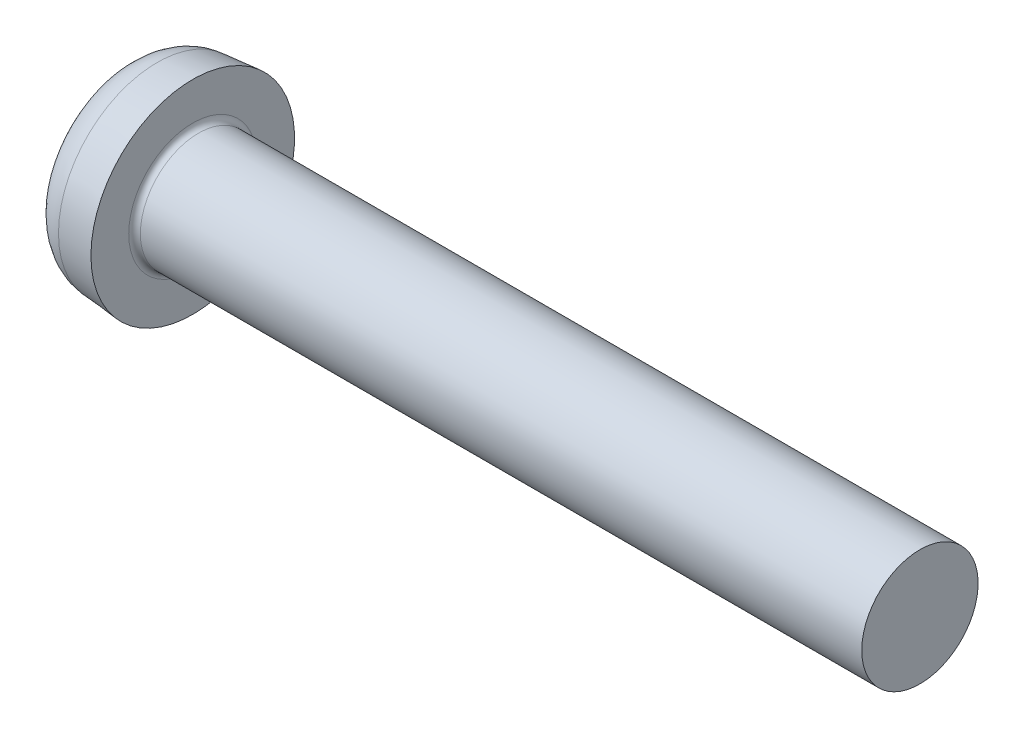
from build123d import *

# Parameters (mm, degrees)
FILLET1_R    = 0.4
RECPAT_COUNT = 2
RECPAT_ANGLE = 90


with BuildPart() as part:
    # BodySke → BaseBody (revolve)
    with BuildSketch(Plane.XY):
        with BuildLine():
            Line((5.4, 4), (5.4, 7))
            Line((5.4, 7), (2.956076559, 6.786184404))
            ThreePointArc((2.956076559, 6.786184404), (1.52557938, 6.199578276), (0.681056287, 4.904506975))
            ThreePointArc((0.681056287, 4.904506975), (0.171077054, 2.475784034), (0, 0))
            Line((0, 0), (55.4, 0))
            Line((55.4, 0), (55.4, 4))
            Line((55.4, 4), (5.4, 4))
        make_face()
    revolve(axis=Axis((0, 0, 0), (1, 0, 0)))

    # Fillet1
    fillet1_edges = [part.edges().sort_by_distance(p)[0] for p in [
        (5.4, -4, 0),
    ]]
    fillet(fillet1_edges, radius=FILLET1_R)

    # RecSkeTop → Recess section 0
    with BuildSketch(Plane(origin=(0, 0, 0), x_dir=(0, 0, -1), z_dir=(1, 0, 0))):
        with BuildLine():
            Line((-0.858, 3.9), (0.858, 3.9))
            Line((0.858, 3.9), (0.858, -3.9))
            Line((0.858, -3.9), (-0.858, -3.9))
            Line((-0.858, -3.9), (-0.858, 3.9))
        make_face()
    # RecSkeBot → Recess section 1
    with BuildSketch(Plane(origin=(4.36, 0, 0), x_dir=(0, 0, -1), z_dir=(1, 0, 0))):
        with BuildLine():
            Line((-0.858, 1.726184552), (0.858, 1.726184552))
            Line((0.858, 1.726184552), (0.858, -1.726184552))
            Line((0.858, -1.726184552), (-0.858, -1.726184552))
            Line((-0.858, -1.726184552), (-0.858, 1.726184552))
        make_face()
    recess = loft(mode=Mode.SUBTRACT)

    # RecPat: Recess ×2 about axis
    recpat_axis = Axis((0, 0, 0), (1, 0, 0))
    for i in range(1, RECPAT_COUNT):
        add(recess.rotate(recpat_axis, i * RECPAT_ANGLE / (RECPAT_COUNT - 1)), mode=Mode.SUBTRACT)

    # RecCorSke → RecessCore (revolve, cut)
    with BuildSketch(Plane.XY):
        Polygon((0, 0), (0, 1.8876), (4.36, 1.5827191), (4.874256609, 0), align=None)
    revolve(axis=Axis((0, 0, 0), (1, 0, 0)), mode=Mode.SUBTRACT)


solid = part.part
